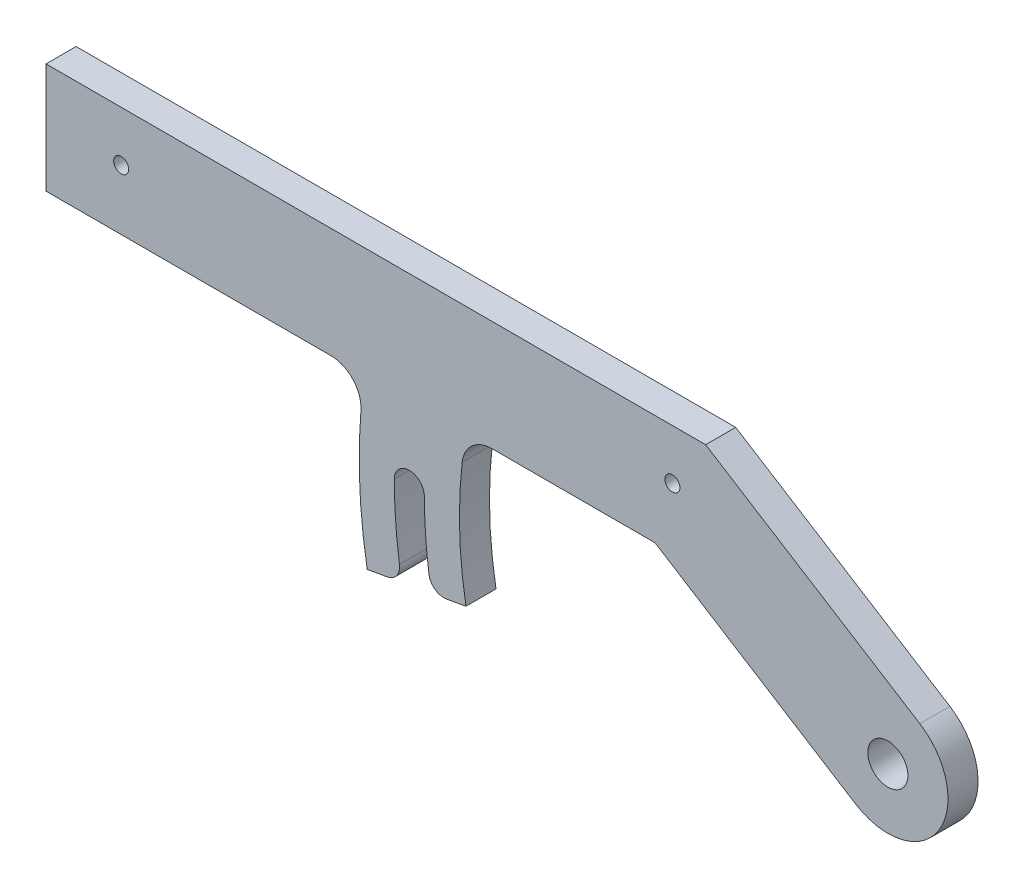
from build123d import *

# Parameters (mm, degrees)
ESBO_O1_R                = 4
ESBO_O1_R_2              = 1.5
RESSALTO_EXTRUS_O1_DEPTH = 6


with BuildPart() as part:
    # Esboço1 → Ressalto-extrusão1 (new body)
    with BuildSketch(Plane.XY):
        with BuildLine():
            Line((76.61878241, -32.162679866), (36.544884845, -7))
            Line((36.544884845, -7), (4.011076726, -7))
            ThreePointArc((4.011076726, -7), (0.015796492, -8.523647037), (-1.950351446, -12.320754717))
            ThreePointArc((-1.950351446, -12.320754717), (-2.46012771, -24.610856515), (-1.201062883, -36.846919191))
            Line((-1.201062883, -36.846919191), (-5.090764505, -37.532778533))
            ThreePointArc((-5.090764505, -37.532778533), (-7.373388797, -37.006623057), (-8.581933922, -34.999976122))
            ThreePointArc((-8.581933922, -34.999976122), (-9.270198027, -28.516176496), (-9.5, -22))
            ThreePointArc((-9.5, -22), (-12.5, -19), (-15.5, -22))
            ThreePointArc((-15.5, -22), (-15.241343046, -29.133618752), (-14.46673063, -36.229772323))
            ThreePointArc((-14.46673063, -36.229772323), (-15.003505065, -38.420028812), (-16.914315963, -39.617589663))
            Line((-16.914315963, -39.617589663), (-20.897217943, -40.319882744))
            ThreePointArc((-20.897217943, -40.319882744), (-22.384170997, -26.9423176), (-22.155755608, -13.484304933))
            ThreePointArc((-22.155755608, -13.484304933), (-23.725631866, -8.932189139), (-28.136177728, -7))
            Line((-28.136177728, -7), (-85, -7))
            Line((-85, -7), (-85, 15))
            Line((-85, 15), (46.64030034, 15))
            Line((46.64030034, 15), (89.38121759, -11.837320134))
            ThreePointArc((89.38121759, -11.837320134), (93.162679866, -28.38121759), (76.61878241, -32.162679866))
        make_face()
        with Locations((83, -22)):
            Circle(ESBO_O1_R, mode=Mode.SUBTRACT)
        with Locations((-70, 5)):
            Circle(ESBO_O1_R_2, mode=Mode.SUBTRACT)
        with Locations((40, 5)):
            Circle(ESBO_O1_R_2, mode=Mode.SUBTRACT)
    extrude(amount=RESSALTO_EXTRUS_O1_DEPTH)


solid = part.part
